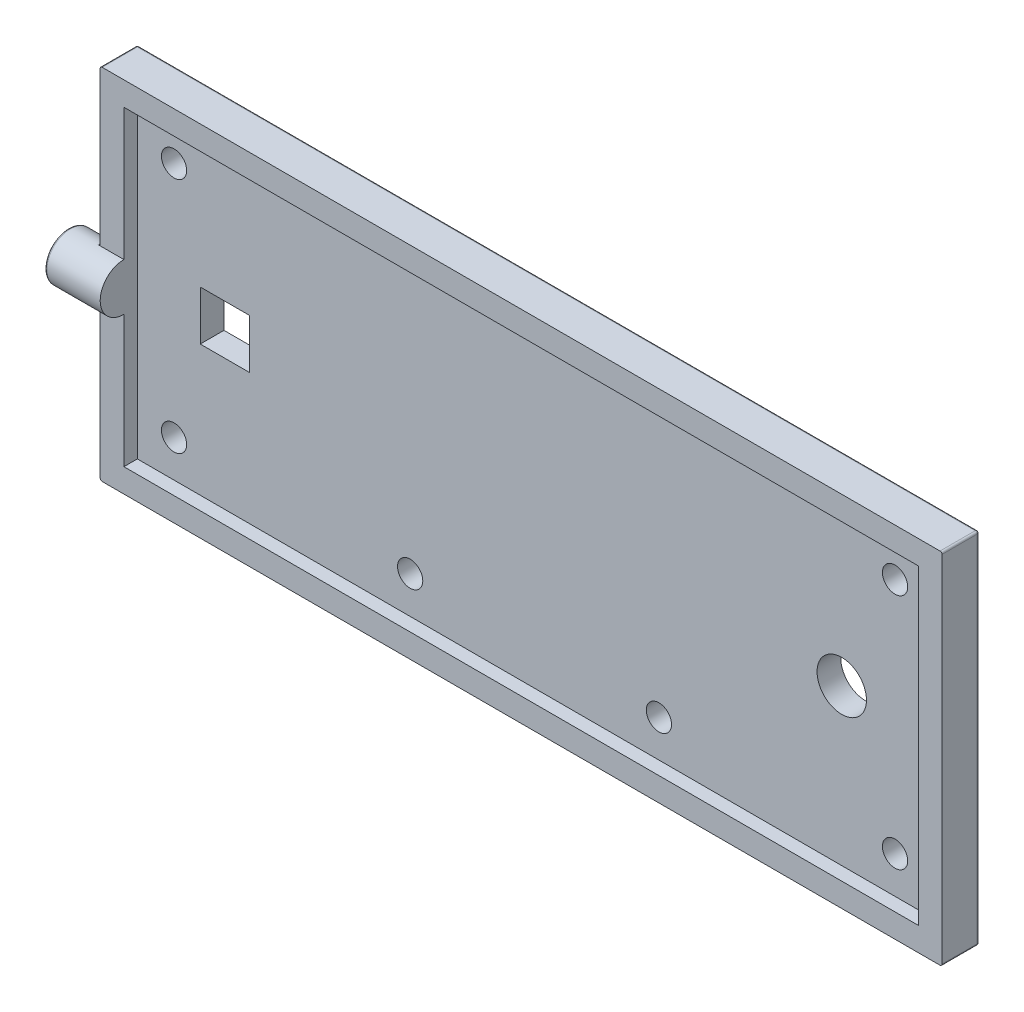
from build123d import *

# Parameters (mm, degrees)
SKETCH1_W                = 100.46
SKETCH1_H                = 39.37
SKETCH1_R                = 1.595
SKETCH1_R_2              = 3.125
SKETCH1_W_2              = 6.25
SKETCH1_H_2              = 6.25
BOSS_EXTRUDE1_DEPTH      = 3
SKETCH1_5_W              = 106.46
SKETCH1_5_H              = 45.37
SKETCH1_5_W_2            = 100.46
SKETCH1_5_H_2            = 39.37
BOSS_EXTRUDE2_DEPTH      = 4.7
BOSS_EXTRUDE3_DEPTH      = 4
BOSS_EXTRUDE3_DEPTH_BACK = 3
SKETCH2_R                = 3
FILLET1_R                = 0.25


with BuildPart() as part:
    # Sketch1 → Boss-Extrude1 (new body)
    with BuildSketch(Plane.XY):
        with Locations((53.23, 22.685)):
            Rectangle(SKETCH1_W, SKETCH1_H)
        with Locations((7.64, 7.68)):
            Circle(SKETCH1_R, mode=Mode.SUBTRACT)
        with Locations((37.5, 7.68)):
            Circle(SKETCH1_R, mode=Mode.SUBTRACT)
        with Locations((68.96, 7.68)):
            Circle(SKETCH1_R, mode=Mode.SUBTRACT)
        with Locations((98.82, 7.68)):
            Circle(SKETCH1_R, mode=Mode.SUBTRACT)
        with Locations((7.64, 37.69)):
            Circle(SKETCH1_R, mode=Mode.SUBTRACT)
        with Locations((98.82, 37.69)):
            Circle(SKETCH1_R, mode=Mode.SUBTRACT)
        with Locations((92.08, 22.685)):
            Circle(SKETCH1_R_2, mode=Mode.SUBTRACT)
        with Locations((14.08, 22.685)):
            Rectangle(SKETCH1_W_2, SKETCH1_H_2, mode=Mode.SUBTRACT)
    extrude(amount=BOSS_EXTRUDE1_DEPTH)

    # Sketch1<5> → Boss-Extrude2 (add)
    with BuildSketch(Plane.XY):
        with Locations((53.23, 22.685)):
            Rectangle(SKETCH1_5_W, SKETCH1_5_H)
        with Locations((53.23, 22.685)):
            Rectangle(SKETCH1_5_W_2, SKETCH1_5_H_2, mode=Mode.SUBTRACT)
    extrude(amount=BOSS_EXTRUDE2_DEPTH)

    # Sketch2 → Boss-Extrude3 (add, two sides: drawn at the far end of the back side and taken through both)
    with BuildSketch(Plane.ZY.offset(-BOSS_EXTRUDE3_DEPTH_BACK)):
        with Locations((4.7, 22.685)):
            Circle(SKETCH2_R)
    extrude(amount=BOSS_EXTRUDE3_DEPTH + BOSS_EXTRUDE3_DEPTH_BACK)

    # Fillet1
    # the kernel refuses this fillet: 0.25 mm, written as the material it adds along each edge
    with BuildSketch(Plane(origin=(0, 22.685, 4.7), x_dir=(0, 1, 0), z_dir=(0, 0, 1))) as fillet1_piece_1:
        with BuildLine():
            CenterArc((3 + FILLET1_R, FILLET1_R), FILLET1_R, 180, 90)
            Line((3 + FILLET1_R, 0), (3, 0))
            Line((3, 0), (3, FILLET1_R))
        make_face()
    revolve(axis=Axis((0, 22.685, 4.7), (-1, 0, 0)), revolution_arc=180)
    # the kernel refuses this fillet: 0.25 mm, written as the material it takes off along each edge
    with BuildSketch(Plane(origin=(0.25, 0.25, 0.25), x_dir=(0, 0, -1), z_dir=(-1, 0, 0))) as fillet1_2_piece_1_section:
        Polygon((0, 0), (FILLET1_R, 0), (FILLET1_R, FILLET1_R), (0, FILLET1_R), align=None)
    fillet1_2_piece_1 = extrude(amount=FILLET1_R, mode=Mode.PRIVATE)
    fillet1_2_piece_1 = fillet1_2_piece_1 - Plane(origin=(0.25, 0.25, 0.25), x_dir=(0, 0.7071067811865475, 0.7071067811865475), z_dir=(-1, 0, 0)) * Sphere(FILLET1_R, mode=Mode.PRIVATE)
    add(fillet1_2_piece_1, mode=Mode.SUBTRACT)
    with BuildSketch(Plane(origin=(106.21, 0.25, 0.25), x_dir=(0, -1, 0), z_dir=(0, 0, -1))) as fillet1_2_piece_2_section:
        Polygon((0, 0), (FILLET1_R, 0), (FILLET1_R, -FILLET1_R), (0, -FILLET1_R), align=None)
    fillet1_2_piece_2 = extrude(amount=FILLET1_R, mode=Mode.PRIVATE)
    fillet1_2_piece_2 = fillet1_2_piece_2 - Plane(origin=(106.21, 0.25, 0.25), x_dir=(-0.7071067811865475, 0.7071067811865475, 0), z_dir=(0, 0, -1)) * Sphere(FILLET1_R, mode=Mode.PRIVATE)
    add(fillet1_2_piece_2, mode=Mode.SUBTRACT)
    with BuildSketch(Plane(origin=(106.21, 45.12, 0.25), x_dir=(1, 0, 0), z_dir=(0, 0, -1))) as fillet1_2_piece_3_section:
        Polygon((0, 0), (FILLET1_R, 0), (FILLET1_R, -FILLET1_R), (0, -FILLET1_R), align=None)
    fillet1_2_piece_3 = extrude(amount=FILLET1_R, mode=Mode.PRIVATE)
    fillet1_2_piece_3 = fillet1_2_piece_3 - Plane(origin=(106.21, 45.12, 0.25), x_dir=(-0.7071067811865475, -0.7071067811865475, 0), z_dir=(0, 0, -1)) * Sphere(FILLET1_R, mode=Mode.PRIVATE)
    add(fillet1_2_piece_3, mode=Mode.SUBTRACT)
    with BuildSketch(Plane(origin=(0.25, 45.12, 0.25), x_dir=(0, 0, -1), z_dir=(-1, 0, 0))) as fillet1_2_piece_4_section:
        Polygon((0, 0), (FILLET1_R, 0), (FILLET1_R, -FILLET1_R), (0, -FILLET1_R), align=None)
    fillet1_2_piece_4 = extrude(amount=FILLET1_R, mode=Mode.PRIVATE)
    fillet1_2_piece_4 = fillet1_2_piece_4 - Plane(origin=(0.25, 45.12, 0.25), x_dir=(0, -0.7071067811865475, 0.7071067811865475), z_dir=(-1, 0, 0)) * Sphere(FILLET1_R, mode=Mode.PRIVATE)
    add(fillet1_2_piece_4, mode=Mode.SUBTRACT)
    with BuildSketch(Plane(origin=(0.25, 0, 0), x_dir=(0, 1, 0), z_dir=(1, 0, 0)), Plane(origin=(106.21, 45.37, 0), x_dir=(0, -1, 0), z_dir=(-1, 0, 0))) as fillet1_2_piece_5:
        with BuildLine():
            CenterArc((FILLET1_R, FILLET1_R), FILLET1_R, 180, 90)
            Line((0, FILLET1_R), (0, 0))
            Line((0, 0), (FILLET1_R, 0))
        make_face()
    extrude(amount=105.96, mode=Mode.SUBTRACT)
    with BuildSketch(Plane(origin=(0, 0, 0.25), x_dir=(1, 0, 0), z_dir=(0, 0, 1))) as fillet1_2_piece_6:
        with BuildLine():
            CenterArc((FILLET1_R, FILLET1_R), FILLET1_R, 180, 90)
            Line((0, FILLET1_R), (0, 0))
            Line((0, 0), (FILLET1_R, 0))
        make_face()
    extrude(amount=5.075, mode=Mode.SUBTRACT)
    with BuildSketch(Plane(origin=(106.46, 0.25, 0), x_dir=(-1, 0, 0), z_dir=(0, 1, 0)), Plane(origin=(0, 45.12, 0), x_dir=(1, 0, 0), z_dir=(0, -1, 0))) as fillet1_2_piece_7:
        with BuildLine():
            CenterArc((FILLET1_R, FILLET1_R), FILLET1_R, 180, 90)
            Line((0, FILLET1_R), (0, 0))
            Line((0, 0), (FILLET1_R, 0))
        make_face()
    extrude(amount=44.87, mode=Mode.SUBTRACT)
    with BuildSketch(Plane(origin=(106.46, 0, 0.25), x_dir=(-1, 0, 0), z_dir=(0, 0, 1)), Plane(origin=(106.46, 45.37, 0.25), x_dir=(0, -1, 0), z_dir=(0, 0, 1)), Plane(origin=(0, 45.37, 0.25), x_dir=(1, 0, 0), z_dir=(0, 0, 1))) as fillet1_2_piece_8:
        with BuildLine():
            CenterArc((FILLET1_R, -FILLET1_R), FILLET1_R, 90, 90)
            Line((0, -FILLET1_R), (0, 0))
            Line((0, 0), (FILLET1_R, 0))
        make_face()
    extrude(amount=5.075, mode=Mode.SUBTRACT)
    with BuildSketch(Plane(origin=(-4, 22.685, 4.7), x_dir=(0, 0, 1), z_dir=(0, -1, 0))) as fillet1_2_piece_9:
        with BuildLine():
            CenterArc((3 - FILLET1_R, -FILLET1_R), FILLET1_R, 0, 90)
            Line((3 - FILLET1_R, 0), (3, 0))
            Line((3, 0), (3, -FILLET1_R))
        make_face()
    revolve(axis=Axis((-4, 22.685, 4.7), (-1, 0, 0)), mode=Mode.SUBTRACT)


solid = part.part
